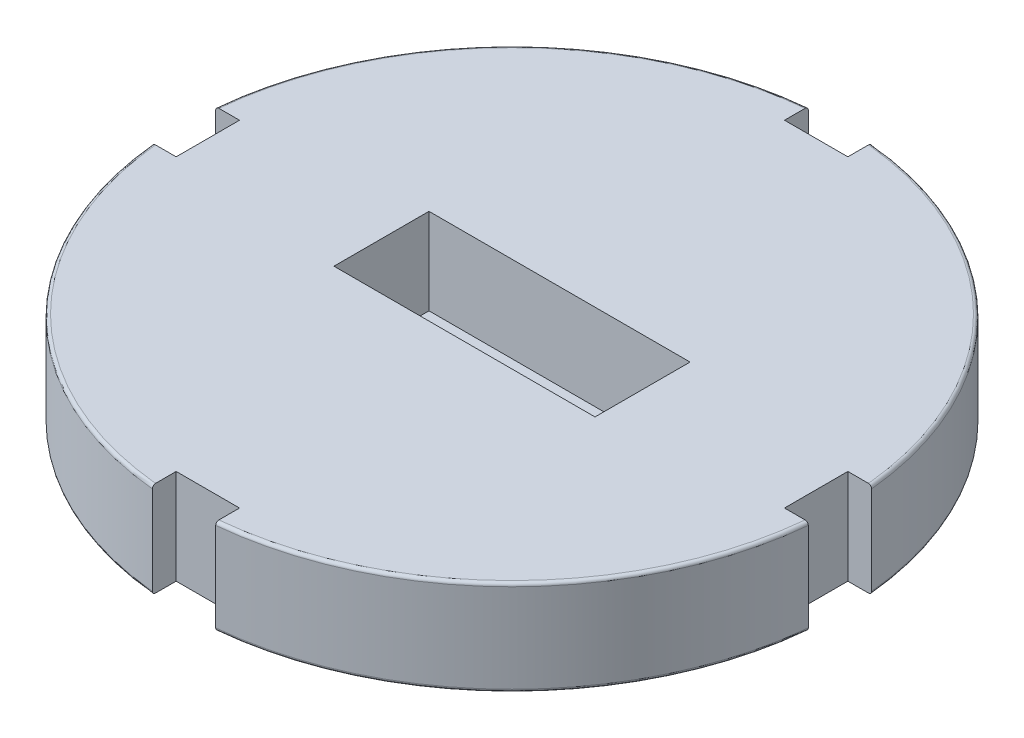
from build123d import *

# Parameters (mm, degrees)
SKETCH2_R           = 66.04
BOSS_EXTRUDE1_DEPTH = 19.05
FILLET1_R           = 0.635
SKETCH4_W           = 12.7
SKETCH4_H           = 9.0994385
SKETCH4_W_2         = 9.0994385
SKETCH4_H_2         = 12.7
CUT_EXTRUDE2_DEPTH  = 96.317709267
SKETCH5_W           = 52.324
SKETCH5_H           = 19.05
CUT_EXTRUDE3_DEPTH  = 17.272


with BuildPart() as part:
    # Sketch2 → Boss-Extrude1 (new body)
    with BuildSketch(Plane(origin=(0, 0, 0), x_dir=(1, 0, 0), z_dir=(0, 1, 0))):
        Circle(SKETCH2_R)
    extrude(amount=BOSS_EXTRUDE1_DEPTH)

    # Fillet1
    fillet1_edges = [part.edges().sort_by_distance(p)[0] for p in [
        (-66.04, 0, 0),
        (-66.04, 19.05, 0),
    ]]
    fillet(fillet1_edges, radius=FILLET1_R)

    # Sketch4 → Cut-Extrude2 (cut, through all)
    with BuildSketch(Plane.XZ):
        with Locations((0, -65.50971925)):
            Rectangle(SKETCH4_W, SKETCH4_H)
        with Locations((-65.50971925, 0)):
            Rectangle(SKETCH4_W_2, SKETCH4_H_2)
        with Locations((0, 65.50971925)):
            Rectangle(SKETCH4_W, SKETCH4_H)
        with Locations((65.50971925, 0)):
            Rectangle(SKETCH4_W_2, SKETCH4_H_2)
    extrude(amount=-CUT_EXTRUDE2_DEPTH, mode=Mode.SUBTRACT)

    # Sketch5 → Cut-Extrude3 (cut)
    with BuildSketch(Plane(origin=(0, 19.05, 0), x_dir=(1, 0, 0), z_dir=(0, 1, 0))):
        Rectangle(SKETCH5_W, SKETCH5_H)
    extrude(amount=-CUT_EXTRUDE3_DEPTH, mode=Mode.SUBTRACT)


solid = part.part
